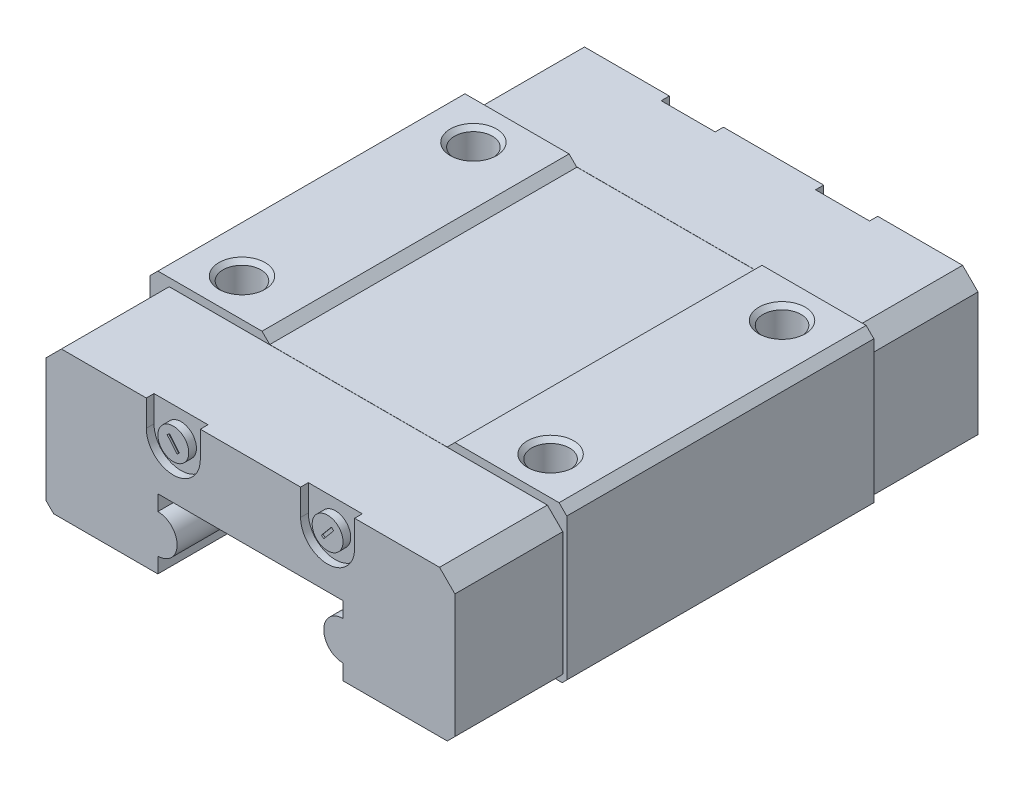
from build123d import *

# Parameters (mm, degrees)
EXTRUDE_1_DEPTH             = 9.95
EXTRUDE_1_DEPTH_BACK        = 9.95
EXTRUDE_2_DEPTH             = 7
SKETCH_3_W                  = 67.8
SKETCH_3_H                  = 67.8
CUT_EXTRUDE_1_DEPTH         = 0.02
EXTRUDE_START               = -7
EXTRUDE_3_DEPTH             = 7
CUT_EXTRUDE_START           = -0.02
SKETCH_5_W                  = 67.8
SKETCH_5_H                  = 67.8
CUT_EXTRUDE_2_DEPTH         = 0.02
CUT_EXTRUDE_3_DEPTH         = 0.53
SKETCH_7_R                  = 1
EXTRUDE_4_DEPTH             = 1
SKETCH_8_R                  = 1
EXTRUDE_5_DEPTH             = 1
CUT_EXTRUDE_START_2         = -0.5
CUT_EXTRUDE_4_DEPTH         = 0.5
EXTRUDE_START_2             = -1
SKETCH_10_R                 = 1
EXTRUDE_6_DEPTH             = 1
SKETCH_11_R                 = 1
EXTRUDE_7_DEPTH             = 1
PATTERN_LINEAR_1_COUNT      = 2
PATTERN_LINEAR_1_PITCH      = 15
PATTERN_LINEAR_1_COUNT_DIR2 = 2
PATTERN_LINEAR_1_PITCH_DIR2 = 20
CUT_EXTRUDE_5_DEPTH         = 0.1
CUT_EXTRUDE_6_DEPTH         = 0.1
CUT_EXTRUDE_7_DEPTH         = 0.1
CUT_EXTRUDE_8_DEPTH         = 0.1


with BuildPart() as part:
    # 草图1 → 凸台-拉伸1 (new, two sides: drawn at the far end of the back side and taken through both)
    with BuildSketch(Plane.XY.offset(-EXTRUDE_1_DEPTH_BACK)):
        with BuildLine():
            Line((-13.5, 9.5), (-13.5, 0.296984848))
            Line((-13.5, 0.296984848), (-13.203015152, 0))
            Line((-13.203015152, 0), (-6, 0))
            Line((-6, 0), (-6, 1))
            ThreePointArc((-6, 1), (-4.75, 2.25), (-6, 3.5))
            Line((-6, 3.5), (-6, 4.5))
            Line((-6, 4.5), (6, 4.5))
            Line((6, 4.5), (6, 3.5))
            ThreePointArc((6, 3.5), (4.75, 2.25), (6, 1))
            Line((6, 1), (6, 0))
            Line((6, 0), (13.203015152, 0))
            Line((13.203015152, 0), (13.5, 0.296984848))
            Line((13.5, 0.296984848), (13.5, 9.5))
            Line((13.5, 9.5), (13, 10))
            Line((13, 10), (6.25, 10))
            Line((6.25, 10), (5.75, 9.5))
            Line((5.75, 9.5), (-5.75, 9.5))
            Line((-5.75, 9.5), (-6.25, 10))
            Line((-6.25, 10), (-13, 10))
            Line((-13, 10), (-13.5, 9.5))
        make_face()
    extrude(amount=EXTRUDE_1_DEPTH + EXTRUDE_1_DEPTH_BACK)

    # 草图2 → 凸台-拉伸2 (add)
    with BuildSketch(Plane.XY.offset(9.95)):
        with BuildLine():
            Line((-13.25, 8.502979439), (-13.25, 0.494974747))
            Line((-13.25, 0.494974747), (-12.755025253, 0))
            Line((-12.755025253, 0), (-6, 0))
            Line((-6, 0), (-6, 1))
            ThreePointArc((-6, 1), (-4.75, 2.25), (-6, 3.5))
            Line((-6, 3.5), (-6, 4.5))
            Line((-6, 4.5), (6, 4.5))
            Line((6, 4.5), (6, 3.5))
            ThreePointArc((6, 3.5), (4.75, 2.25), (6, 1))
            Line((6, 1), (6, 0))
            Line((6, 0), (12.755025253, 0))
            Line((12.755025253, 0), (13.25, 0.494974747))
            Line((13.25, 0.494974747), (13.25, 8.502979439))
            Line((13.25, 8.502979439), (12.252979439, 9.5))
            Line((12.252979439, 9.5), (-12.252979439, 9.5))
            Line((-12.252979439, 9.5), (-13.25, 8.502979439))
        make_face()
    extrude(amount=EXTRUDE_2_DEPTH)

    # 草图3 → 切除-拉伸1 (cut)
    with BuildSketch(Plane.XY.offset(9.95)):
        Rectangle(SKETCH_3_W, SKETCH_3_H)
        with BuildLine():
            Line((-13.24, 8.492979439), (-13.24, 0.504974747))
            Line((-13.24, 0.504974747), (-12.745025253, 0.01))
            Line((-12.745025253, 0.01), (-6.01, 0.01))
            Line((-6.01, 0.01), (-6.01, 1.03))
            ThreePointArc((-6.01, 1.03), (-4.78, 2.26), (-6.01, 3.49))
            Line((-6.01, 3.49), (-6.01, 4.52))
            Line((-6.01, 4.52), (6.01, 4.52))
            Line((6.01, 4.52), (6.01, 3.49))
            ThreePointArc((6.01, 3.49), (4.78, 2.26), (6.01, 1.03))
            Line((6.01, 1.03), (6.01, 0.01))
            Line((6.01, 0.01), (12.745025253, 0.01))
            Line((12.745025253, 0.01), (13.24, 0.504974747))
            Line((13.24, 0.504974747), (13.24, 8.492979439))
            Line((13.24, 8.492979439), (12.242979439, 9.49))
            Line((12.242979439, 9.49), (-12.242979439, 9.49))
            Line((-12.242979439, 9.49), (-13.24, 8.492979439))
        make_face(mode=Mode.SUBTRACT)
    extrude(amount=CUT_EXTRUDE_1_DEPTH, mode=Mode.SUBTRACT)

    # 草图4 → 凸台-拉伸3 (add)
    with BuildSketch(Plane.XY.offset(-9.95).offset(EXTRUDE_START)):
        with BuildLine():
            Line((-13.25, 8.502979439), (-13.25, 0.494974747))
            Line((-13.25, 0.494974747), (-12.755025253, 0))
            Line((-12.755025253, 0), (-6, 0))
            Line((-6, 0), (-6, 1))
            ThreePointArc((-6, 1), (-4.75, 2.25), (-6, 3.5))
            Line((-6, 3.5), (-6, 4.5))
            Line((-6, 4.5), (6, 4.5))
            Line((6, 4.5), (6, 3.5))
            ThreePointArc((6, 3.5), (4.75, 2.25), (6, 1))
            Line((6, 1), (6, 0))
            Line((6, 0), (12.755025253, 0))
            Line((12.755025253, 0), (13.25, 0.494974747))
            Line((13.25, 0.494974747), (13.25, 8.502979439))
            Line((13.25, 8.502979439), (12.252979439, 9.5))
            Line((12.252979439, 9.5), (-12.252979439, 9.5))
            Line((-12.252979439, 9.5), (-13.25, 8.502979439))
        make_face()
    extrude(amount=EXTRUDE_3_DEPTH)

    # 草图5 → 切除-拉伸2 (cut)
    with BuildSketch(Plane.XY.offset(-9.95).offset(CUT_EXTRUDE_START)):
        Rectangle(SKETCH_5_W, SKETCH_5_H)
        with BuildLine():
            Line((-13.24, 8.492979439), (-13.24, 0.504974747))
            Line((-13.24, 0.504974747), (-12.745025253, 0.01))
            Line((-12.745025253, 0.01), (-6.01, 0.01))
            Line((-6.01, 0.01), (-6.01, 1.03))
            ThreePointArc((-6.01, 1.03), (-4.78, 2.26), (-6.01, 3.49))
            Line((-6.01, 3.49), (-6.01, 4.52))
            Line((-6.01, 4.52), (6.01, 4.52))
            Line((6.01, 4.52), (6.01, 3.49))
            ThreePointArc((6.01, 3.49), (4.78, 2.26), (6.01, 1.03))
            Line((6.01, 1.03), (6.01, 0.01))
            Line((6.01, 0.01), (12.745025253, 0.01))
            Line((12.745025253, 0.01), (13.24, 0.504974747))
            Line((13.24, 0.504974747), (13.24, 8.492979439))
            Line((13.24, 8.492979439), (12.242979439, 9.49))
            Line((12.242979439, 9.49), (-12.242979439, 9.49))
            Line((-12.242979439, 9.49), (-13.24, 8.492979439))
        make_face(mode=Mode.SUBTRACT)
    extrude(amount=CUT_EXTRUDE_2_DEPTH, mode=Mode.SUBTRACT)

    # 草图6 → 切除-拉伸3 (cut)
    with BuildSketch(Plane.XY.offset(-16.95)):
        with BuildLine():
            Line((-6.75, 26), (-6.75, 7.8))
            ThreePointArc((-6.75, 7.8), (-5, 6.05), (-3.25, 7.8))
            Line((-3.25, 7.8), (-3.25, 24.82500207))
            Line((-3.25, 24.82500207), (3.25, 24.82500207))
            Line((3.25, 24.82500207), (3.25, 7.8))
            ThreePointArc((3.25, 7.8), (5, 6.05), (6.75, 7.8))
            Line((6.75, 7.8), (6.75, 26))
            Line((6.75, 26), (-6.75, 26))
        make_face()
    extrude(amount=CUT_EXTRUDE_3_DEPTH, mode=Mode.SUBTRACT)

    # 草图7 → 凸台-拉伸4 (add)
    with BuildSketch(Plane.XY.offset(-16.95)):
        with Locations((-5, 7.8)):
            Circle(SKETCH_7_R)
    extrude(amount=EXTRUDE_4_DEPTH)

    # 草图8 → 凸台-拉伸5 (add)
    with BuildSketch(Plane.XY.offset(-16.95)):
        with Locations((5, 7.8)):
            Circle(SKETCH_8_R)
    extrude(amount=EXTRUDE_5_DEPTH)

    # 草图9 → 切除-拉伸4 (cut)
    with BuildSketch(Plane.XY.offset(16.95).offset(CUT_EXTRUDE_START_2)):
        with BuildLine():
            Line((-6.75, 26), (-6.75, 7.8))
            ThreePointArc((-6.75, 7.8), (-5, 6.05), (-3.25, 7.8))
            Line((-3.25, 7.8), (-3.25, 24.82500207))
            Line((-3.25, 24.82500207), (3.25, 24.82500207))
            Line((3.25, 24.82500207), (3.25, 7.8))
            ThreePointArc((3.25, 7.8), (5, 6.05), (6.75, 7.8))
            Line((6.75, 7.8), (6.75, 26))
            Line((6.75, 26), (-6.75, 26))
        make_face()
    extrude(amount=CUT_EXTRUDE_4_DEPTH, mode=Mode.SUBTRACT)

    # 草图10 → 凸台-拉伸6 (add)
    with BuildSketch(Plane.XY.offset(16.95).offset(EXTRUDE_START_2)):
        with Locations((-5, 7.8)):
            Circle(SKETCH_10_R)
    extrude(amount=EXTRUDE_6_DEPTH)

    # 草图11 → 凸台-拉伸7 (add)
    with BuildSketch(Plane.XY.offset(16.95).offset(EXTRUDE_START_2)):
        with Locations((5, 7.8)):
            Circle(SKETCH_11_R)
    extrude(amount=EXTRUDE_7_DEPTH)

    # 草图12 → 切除-旋转1 (revolve, cut)
    with BuildSketch(Plane(origin=(10, 0, 0), x_dir=(0, 0, -1), z_dir=(1, 0, 0))):
        Polygon((-7.5, 10), (-6, 10), (-6.2705, 9.7295), (-6.2705, 5.459852156), (-7.5, 4.75), align=None)
    cut_revolve_1 = revolve(axis=Axis((10, 4.75, 7.5), (0, 1, 0)), mode=Mode.SUBTRACT)

    # 阵列(线性)1: Cut-Revolve 1 2 × 2
    with Locations(*[(-j * PATTERN_LINEAR_1_PITCH_DIR2, 0, -i * PATTERN_LINEAR_1_PITCH) for i in range(PATTERN_LINEAR_1_COUNT) for j in range(PATTERN_LINEAR_1_COUNT_DIR2) if (i, j) != (0, 0)]):
        add(cut_revolve_1, mode=Mode.SUBTRACT)

    # 草图14 → 切除-拉伸5 (cut)
    with BuildSketch(Plane.XY.offset(16.95)):
        Polygon((4.602001751, 7.481256539), (4.755210639, 7.352699017), (5.397998249, 8.118743461), (5.244789361, 8.247300983), align=None)
    extrude(amount=-CUT_EXTRUDE_5_DEPTH, mode=Mode.SUBTRACT)

    # 草图15 → 切除-拉伸6 (cut)
    with BuildSketch(Plane.XY.offset(16.95)):
        Polygon((-5.397998249, 8.118743461), (-4.755210639, 7.352699017), (-4.602001751, 7.481256539), (-5.244789361, 8.247300983), align=None)
    extrude(amount=-CUT_EXTRUDE_6_DEPTH, mode=Mode.SUBTRACT)

    # 草图16 → 切除-拉伸7 (cut)
    with BuildSketch(Plane.XY.offset(-16.95)):
        Polygon((4.602001751, 7.481256539), (4.755210639, 7.352699017), (5.397998249, 8.118743461), (5.244789361, 8.247300983), align=None)
    extrude(amount=CUT_EXTRUDE_7_DEPTH, mode=Mode.SUBTRACT)

    # 草图17 → 切除-拉伸8 (cut)
    with BuildSketch(Plane.XY.offset(-16.95)):
        Polygon((-5.397998249, 8.118743461), (-4.755210639, 7.352699017), (-4.602001751, 7.481256539), (-5.244789361, 8.247300983), align=None)
    extrude(amount=CUT_EXTRUDE_8_DEPTH, mode=Mode.SUBTRACT)


solid = part.part
